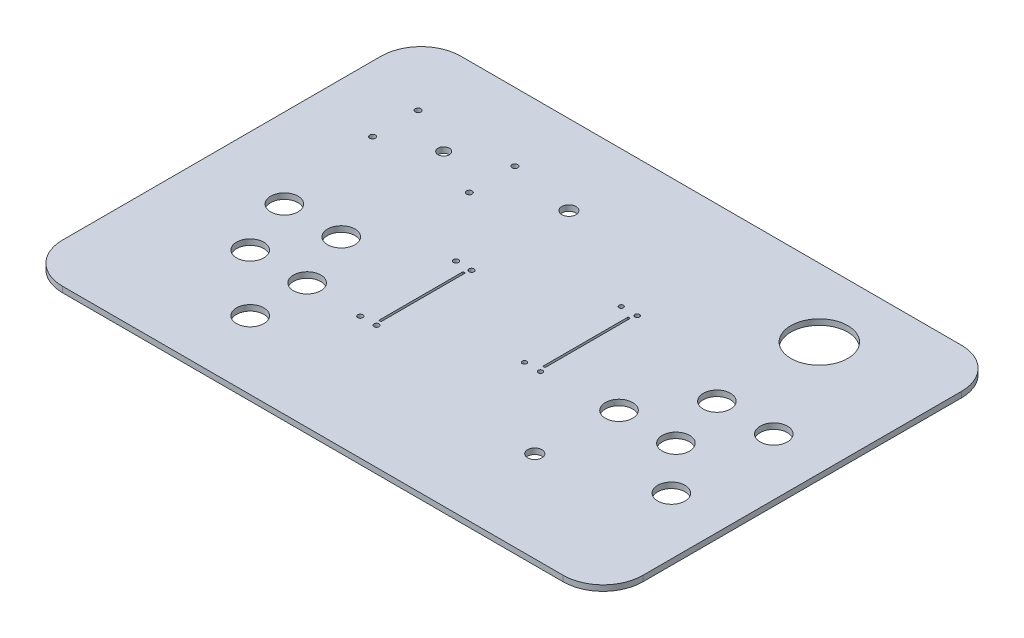
from build123d import *

# Parameters (mm, degrees)
SKETCH1_W               = 510
SKETCH1_H               = 350
BOSS_EXTRUDE1_DEPTH     = 5
SKETCH2_R               = 5
SKETCH2_R_2             = 2.5
F_1_JOYYSTICK_DEPTH     = 619.566892098
SKETCH3_R               = 12
F_1_BUTTONS_DEPTH       = 619.566892098
SKETCH4_R               = 6.25
F_1_ROCKET_SWITCH_DEPTH = 619.566892098
SKETCH5_R               = 2.25
SKETCH5_W               = 2
SKETCH5_H               = 74
F_1_POTENTIOMETER_DEPTH = 619.566892098
FILLET1_R               = 35
SKETCH6_R               = 12
F_2_BUTTONS_DEPTH       = 619.566892098
SKETCH8_R               = 2
SKETCH8_W               = 2
SKETCH8_H               = 75
F_2_POTENTIOMETER_DEPTH = 619.566892098
SKETCH9_R               = 25
F_2_SPEAKER_DEPTH       = 619.566892098
SKETCH10_R              = 6.25
F_2_ROCKET_SWITCH_DEPTH = 619.566892098


with BuildPart() as part:
    # Sketch1 → Boss-Extrude1 (new body)
    with BuildSketch(Plane(origin=(0, 0, 0), x_dir=(1, 0, 0), z_dir=(0, 1, 0))):
        with Locations((255, 175)):
            Rectangle(SKETCH1_W, SKETCH1_H)
    extrude(amount=BOSS_EXTRUDE1_DEPTH)

    # Sketch2 → 1 Joyystick (cut, through all)
    with BuildSketch(Plane(origin=(0, 5, 0), x_dir=(1, 0, 0), z_dir=(0, 1, 0))):
        with Locations((100, 270)):
            Circle(SKETCH2_R)
        with Locations((142.5, 290)):
            Circle(SKETCH2_R_2)
        with Locations((142.5, 250)):
            Circle(SKETCH2_R_2)
        with Locations((57.5, 250)):
            Circle(SKETCH2_R_2)
        with Locations((57.5, 290)):
            Circle(SKETCH2_R_2)
    extrude(amount=-F_1_JOYYSTICK_DEPTH, mode=Mode.SUBTRACT)

    # Sketch3 → 1 Buttons (cut, through all)
    with BuildSketch(Plane(origin=(0, 5, 0), x_dir=(1, 0, 0), z_dir=(0, 1, 0))):
        with Locations((70, 160)):
            Circle(SKETCH3_R)
        with Locations((120, 160)):
            Circle(SKETCH3_R)
        with Locations((90, 110)):
            Circle(SKETCH3_R)
        with Locations((140, 110)):
            Circle(SKETCH3_R)
        with Locations((140, 60)):
            Circle(SKETCH3_R)
    extrude(amount=-F_1_BUTTONS_DEPTH, mode=Mode.SUBTRACT)

    # Sketch4 → 1 Rocket Switch (cut, through all)
    with BuildSketch(Plane(origin=(0, 5, 0), x_dir=(1, 0, 0), z_dir=(0, 1, 0))):
        with Locations((200, 280)):
            Circle(SKETCH4_R)
    extrude(amount=-F_1_ROCKET_SWITCH_DEPTH, mode=Mode.SUBTRACT)

    # Sketch5 → 1 Potentiometer (cut, through all)
    with BuildSketch(Plane(origin=(0, 5, 0), x_dir=(1, 0, 0), z_dir=(0, 1, 0))):
        with Locations((188.719749064, 192)):
            Circle(SKETCH5_R)
        with Locations((202.718338039, 191.801237073)):
            Circle(SKETCH5_R)
        with Locations((202.718338039, 108.198762927)):
            Circle(SKETCH5_R)
        with Locations((188.719749064, 108)):
            Circle(SKETCH5_R)
        with Locations((201, 150)):
            Rectangle(SKETCH5_W, SKETCH5_H)
    extrude(amount=-F_1_POTENTIOMETER_DEPTH, mode=Mode.SUBTRACT)

    # Fillet1
    fillet1_edges = [part.edges().sort_by_distance(p)[0] for p in [
        (0, 2.5, 0),
        (510, 2.5, 0),
        (510, 2.5, -350),
        (0, 2.5, -350),
    ]]
    fillet(fillet1_edges, radius=FILLET1_R)

    # Sketch6 → 2 Buttons (cut, through all)
    with BuildSketch(Plane(origin=(0, 5, 0), x_dir=(1, 0, 0), z_dir=(0, 1, 0))):
        with Locations((460, 200)):
            Circle(SKETCH6_R)
        with Locations((410, 200)):
            Circle(SKETCH6_R)
        with Locations((424.025675508, 150)):
            Circle(SKETCH6_R)
        with Locations((374.025675508, 150)):
            Circle(SKETCH6_R)
        with Locations((460, 110)):
            Circle(SKETCH6_R)
    extrude(amount=-F_2_BUTTONS_DEPTH, mode=Mode.SUBTRACT)

    # Sketch8 → 2 Potentiometer (cut, through all)
    with BuildSketch(Plane(origin=(0, 5, 0), x_dir=(1, 0, 0), z_dir=(0, 1, 0))):
        with Locations((310, 230)):
            Circle(SKETCH8_R)
        with Locations((310, 145)):
            Circle(SKETCH8_R)
        with Locations((296, 145)):
            Circle(SKETCH8_R)
        with Locations((296, 230)):
            Circle(SKETCH8_R)
        with Locations((308, 187.5)):
            Rectangle(SKETCH8_W, SKETCH8_H)
    extrude(amount=-F_2_POTENTIOMETER_DEPTH, mode=Mode.SUBTRACT)

    # Sketch9 → 2 speaker (cut, through all)
    with BuildSketch(Plane(origin=(0, 5, 0), x_dir=(1, 0, 0), z_dir=(0, 1, 0))):
        with Locations((410, 290)):
            Circle(SKETCH9_R)
    extrude(amount=-F_2_SPEAKER_DEPTH, mode=Mode.SUBTRACT)

    # Sketch10 → 2 Rocket Switch (cut, through all)
    with BuildSketch(Plane(origin=(0, 5, 0), x_dir=(1, 0, 0), z_dir=(0, 1, 0))):
        with Locations((370, 80)):
            Circle(SKETCH10_R)
    extrude(amount=-F_2_ROCKET_SWITCH_DEPTH, mode=Mode.SUBTRACT)


solid = part.part
